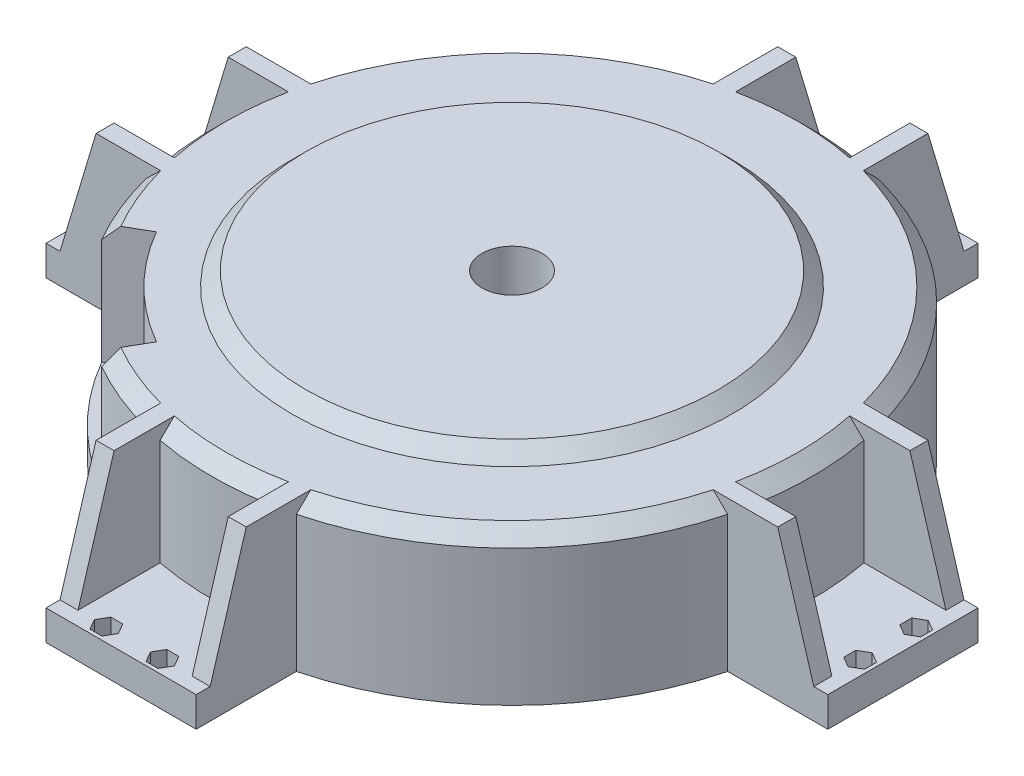
from build123d import *

# Parameters (mm, degrees)
BOSS_EXTRUDE1_DEPTH                      = 37.5
SKETCH4_W                                = 3.5
SKETCH4_H                                = 30
CUT_EXTRUDE1_DEPTH                       = 37.5
SKETCH7_W                                = 3.5
SKETCH7_H                                = 30
CUT_EXTRUDE3_DEPTH                       = 157.454118834
CUT_EXTRUDE4_START                       = -30
CUT_EXTRUDE4_DEPTH                       = 30
CHAMFER1_SIZE                            = 3.5
CUT_EXTRUDE5_DEPTH                       = 157.454118834
MIRROR4_AT_THE_SECOND_PLANE_COPY_1_DEPTH = 157.454118834
CUT_EXTRUDE6_DEPTH                       = 157.454118834
CUT_EXTRUDE7_DEPTH                       = 144.057956088
CUT_EXTRUDE7_DEPTH_BACK                  = 30
SKETCH14_R                               = 55
BOSS_EXTRUDE3_DEPTH                      = 3.5
CHAMFER2_SIZE                            = 3.5
SKETCH15_R                               = 7.5
CUT_EXTRUDE8_DEPTH                       = 25


with BuildPart() as part:
    # Sketch2 → Boss-Extrude1 (new body)
    with BuildSketch(Plane(origin=(0, 0, 0), x_dir=(1, 0, 0), z_dir=(0, 1, 0))):
        with BuildLine():
            Line((97.62, 0), (97.62, 18.75))
            Line((97.62, 18.75), (72.618437741, 18.75))
            ThreePointArc((72.618437741, 18.75), (53.033008589, 53.033008589), (18.75, 72.618437741))
            Line((18.75, 72.618437741), (18.75, 97.62))
            Line((18.75, 97.62), (0, 97.62))
            Line((0, 97.62), (-18.75, 97.62))
            Line((-18.75, 97.62), (-18.75, 72.618437741))
            ThreePointArc((-18.75, 72.618437741), (-53.033008589, 53.033008589), (-72.618437741, 18.75))
            Line((-72.618437741, 18.75), (-97.62, 18.75))
            Line((-97.62, 18.75), (-97.62, 0))
            Line((-97.62, 0), (-97.62, -18.75))
            Line((-97.62, -18.75), (-72.618437741, -18.75))
            ThreePointArc((-72.618437741, -18.75), (-53.033008589, -53.033008589), (-18.75, -72.618437741))
            Line((-18.75, -72.618437741), (-18.75, -97.62))
            Line((-18.75, -97.62), (0, -97.62))
            Line((0, -97.62), (18.75, -97.62))
            Line((18.75, -97.62), (18.75, -72.618437741))
            ThreePointArc((18.75, -72.618437741), (53.033008589, -53.033008589), (72.618437741, -18.75))
            Line((72.618437741, -18.75), (97.62, -18.75))
            Line((97.62, -18.75), (97.62, 0))
        make_face()
        Polygon((8.323894459, -96.71614814), (5.323896931, -96.72), (3.820562359, -94.12385186), (5.317225314, -91.52385186), (8.317222841, -91.52), (9.820557413, -94.11614814), align=None, mode=Mode.SUBTRACT)
        Polygon((-5.682777159, -96.72), (-4.179442587, -94.12385186), (-5.676105541, -91.52385186), (-8.676103069, -91.52), (-10.179437641, -94.11614814), (-8.682774686, -96.71614814), align=None, mode=Mode.SUBTRACT)
        Polygon((-96.71614814, -8.323894459), (-96.72, -5.323896931), (-94.12385186, -3.820562359), (-91.52385186, -5.317225314), (-91.52, -8.317222841), (-94.11614814, -9.820557413), align=None, mode=Mode.SUBTRACT)
        Polygon((96.72, -5.682777159), (94.12385186, -4.179442587), (91.52385186, -5.676105541), (91.52, -8.676103069), (94.11614814, -10.179437641), (96.71614814, -8.682774686), align=None, mode=Mode.SUBTRACT)
        Polygon((96.71614814, 8.323894459), (96.72, 5.323896931), (94.12385186, 3.820562359), (91.52385186, 5.317225314), (91.52, 8.317222841), (94.11614814, 9.820557413), align=None, mode=Mode.SUBTRACT)
        Polygon((-96.72, 5.682777159), (-94.12385186, 4.179442587), (-91.52385186, 5.676105541), (-91.52, 8.676103069), (-94.11614814, 10.179437641), (-96.71614814, 8.682774686), align=None, mode=Mode.SUBTRACT)
        Polygon((-8.323894459, 96.71614814), (-5.323896931, 96.72), (-3.820562359, 94.12385186), (-5.317225314, 91.52385186), (-8.317222841, 91.52), (-9.820557413, 94.11614814), align=None, mode=Mode.SUBTRACT)
        Polygon((5.682777159, 96.72), (4.179442587, 94.12385186), (5.676105541, 91.52385186), (8.676103069, 91.52), (10.179437641, 94.11614814), (8.682774686, 96.71614814), align=None, mode=Mode.SUBTRACT)
    extrude(amount=BOSS_EXTRUDE1_DEPTH)

    # Sketch4 → Cut-Extrude1 (cut)
    with BuildSketch(Plane.XY.offset(18.75)):
        with Locations((-95.87, 22.5)):
            Rectangle(SKETCH4_W, SKETCH4_H)
    cut_extrude1 = extrude(amount=-CUT_EXTRUDE1_DEPTH, mode=Mode.SUBTRACT)

    # Sketch7 → Cut-Extrude3 (cut, through all)
    with BuildSketch(Plane(origin=(18.75, 0, 0), x_dir=(0, 0, -1), z_dir=(1, 0, 0))):
        with Locations((-95.87, 22.5)):
            Rectangle(SKETCH7_W, SKETCH7_H)
    cut_extrude3 = extrude(amount=-CUT_EXTRUDE3_DEPTH, mode=Mode.SUBTRACT)

    # Mirror1: Cut-Extrude3 across plane
    add(cut_extrude3.mirror(Plane.XY), mode=Mode.SUBTRACT)

    # Mirror2: Cut-Extrude1 across plane
    add(cut_extrude1.mirror(Plane.ZY), mode=Mode.SUBTRACT)

    # Sketch8 → Cut-Extrude4 (cut)
    with BuildSketch(Plane(origin=(0, 37.5, 0), x_dir=(1, 0, 0), z_dir=(0, 1, 0)).offset(CUT_EXTRUDE4_START)):
        with BuildLine():
            Line((-14.25, 94.12), (-14.25, 73.633806774))
            ThreePointArc((-14.25, 73.633806774), (0, 75), (14.25, 73.633806774))
            Line((14.25, 73.633806774), (14.25, 94.12))
            Line((14.25, 94.12), (-14.25, 94.12))
        make_face()
        with BuildLine():
            Line((-94.12, 14.25), (-94.12, -14.25))
            Line((-94.12, -14.25), (-73.633806774, -14.25))
            ThreePointArc((-73.633806774, -14.25), (-75, 0), (-73.633806774, 14.25))
            Line((-73.633806774, 14.25), (-94.12, 14.25))
        make_face()
    cut_extrude4 = extrude(amount=CUT_EXTRUDE4_DEPTH, mode=Mode.SUBTRACT)

    # Mirror3: Cut-Extrude4 across plane
    add(cut_extrude4.mirror(Plane.ZY), mode=Mode.SUBTRACT)

    # Mirror3 at the second plane: Cut-Extrude4 across plane
    add(cut_extrude4.mirror(Plane.XY), mode=Mode.SUBTRACT)

    # Chamfer1
    chamfer1_edges = [part.edges().sort_by_distance(p)[0] for p in [
        (53.033008589, 37.5, -53.033008589),
        (0, 37.5, -75),
        (-75, 37.5, 0),
        (0, 37.5, 75),
        (-53.033008589, 37.5, -53.033008589),
        (75, 37.5, 0),
        (-53.033008589, 37.5, 53.033008589),
        (53.033008589, 37.5, 53.033008589),
    ]]
    chamfer(chamfer1_edges, length=CHAMFER1_SIZE)

    # Sketch9 → Cut-Extrude5 (cut, symmetric)
    with BuildSketch(Plane(origin=(18.75, 0, 0), x_dir=(0, 0, -1), z_dir=(1, 0, 0))):
        Polygon((-85.118437741, 37.5), (-94.12, 7.5), (-94.12, 37.5), align=None)
    cut_extrude5 = extrude(amount=CUT_EXTRUDE5_DEPTH, both=True, mode=Mode.SUBTRACT)

    # Mirror4: Cut-Extrude5 across plane
    add(cut_extrude5.mirror(Plane.ZY), mode=Mode.SUBTRACT)

    # Mirror4 at the second plane: Cut-Extrude5 across plane
    add(cut_extrude5.mirror(Plane.XY), mode=Mode.SUBTRACT)

    # Mirror4 at the second plane copy 1 sketc → Mirror4 at the second plane copy 1 (cut, symmetric)
    with BuildSketch(Plane.ZY.offset(18.75)):
        Polygon((-85.118437741, 37.5), (-94.12, 7.5), (-94.12, 37.5), align=None)
    extrude(amount=MIRROR4_AT_THE_SECOND_PLANE_COPY_1_DEPTH, both=True, mode=Mode.SUBTRACT)

    # Sketch10 → Cut-Extrude6 (cut, symmetric)
    with BuildSketch(Plane.XY.offset(18.75)):
        Polygon((-85.118437741, 37.5), (-94.12, 7.5), (-94.12, 37.5), align=None)
    cut_extrude6 = extrude(amount=CUT_EXTRUDE6_DEPTH, both=True, mode=Mode.SUBTRACT)

    # Mirror5: Cut-Extrude6 across plane
    add(cut_extrude6.mirror(Plane.ZY), mode=Mode.SUBTRACT)

    # Sketch11 → Cut-Extrude7 (cut, two sides: drawn at the far end of the back side and taken through both)
    with BuildSketch(Plane(origin=(0, 37.5, 0), x_dir=(1, 0, 0), z_dir=(0, 1, 0)).offset(-CUT_EXTRUDE7_DEPTH_BACK)):
        with BuildLine():
            Line((-56.291651246, -32.5), (-64.951905284, -37.5))
            ThreePointArc((-64.951905284, -37.5), (-53.033008589, -53.033008589), (-37.5, -64.951905284))
            Line((-37.5, -64.951905284), (-32.5, -56.291651246))
            ThreePointArc((-32.5, -56.291651246), (-45.961940777, -45.961940777), (-56.291651246, -32.5))
        make_face()
    extrude(amount=CUT_EXTRUDE7_DEPTH + CUT_EXTRUDE7_DEPTH_BACK, mode=Mode.SUBTRACT)

    # Sketch14 → Boss-Extrude3 (add)
    with BuildSketch(Plane(origin=(0, 37.5, 0), x_dir=(1, 0, 0), z_dir=(0, 1, 0))):
        with Locations(Location((0, 0, 0), (0, 0, 270))):
            Circle(SKETCH14_R)
    extrude(amount=BOSS_EXTRUDE3_DEPTH)

    # Chamfer2
    chamfer2_edges = [part.edges().sort_by_distance(p)[0] for p in [
        (0, 41, -55),
    ]]
    chamfer(chamfer2_edges, length=CHAMFER2_SIZE - 0.0001)  # a hair under: the kernel refuses the full size

    # Sketch15 → Cut-Extrude8 (cut)
    with BuildSketch(Plane(origin=(0, 41, 0), x_dir=(1, 0, 0), z_dir=(0, 1, 0))):
        with Locations(Location((0, 0, 0), (0, 0, 270))):
            Circle(SKETCH15_R)
    extrude(amount=-CUT_EXTRUDE8_DEPTH, mode=Mode.SUBTRACT)


solid = part.part
